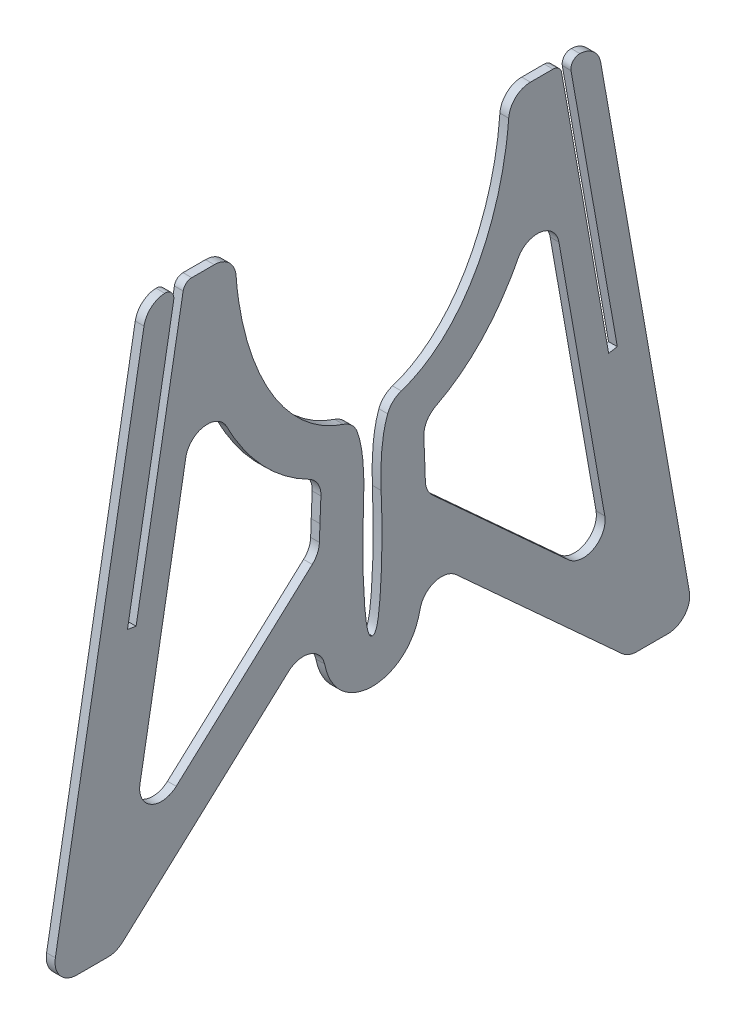
from build123d import *

# Parameters (mm, degrees)
BOSS_EXTRUDE1_START = -2
BOSS_EXTRUDE1_DEPTH = 2
CUT_EXTRUDE1_DEPTH  = 146.045019426
FILLET1_R           = 5
FILLET2_R           = 2


# Read off the part's stored shape, not the designer's step: Boss-Extrude1
with BuildPart() as part:
    # Boss-Extrude1 outline → Boss-Extrude1 (new body)
    with BuildSketch(Plane(origin=(0, 0, 0), x_dir=(0, 0, -1), z_dir=(1, 0, 0)).offset(BOSS_EXTRUDE1_START)):
        with BuildLine():
            Line((-31.104159696, 0), (-42.993921781, 0))
            Line((-42.993921781, 0), (-54.044792455, -62.672601944))
            Line((-54.044792455, -62.672601944), (-56.014407961, -62.325305589))
            Line((-56.014407961, -62.325305589), (-45.024775005, 0))
            Line((-45.024775005, 0), (-51.509348393, 0))
            Line((-51.509348393, 0), (-73.549852023, -124.997907533))
            Line((-73.549852023, -124.997907533), (-58.549852023, -124.997907533))
            Line((-58.549852023, -124.997907533), (-11.939671934, -82.474840347))
            add(Edge.make_bspline(
                [(-11.939671934, -82.474840347), (-11.935355711, -82.553696323), (-11.908963684, -83.029101377), (-11.861198564, -83.821519444), (-11.790671809, -84.858980093), (-11.717513927, -85.824379118), (-11.632640544, -86.818484558), (-11.531749306, -87.845762079), (-11.427577538, -88.745558158), (-11.327177243, -89.498001974), (-11.236962263, -90.105748379), (-11.128638978, -90.7493146), (-10.998597733, -91.430627515), (-10.825309589, -92.209112463), (-10.630662891, -92.95026858), (-10.40253371, -93.673319472), (-10.192750893, -94.265013644), (-9.871313525, -95.045802044), (-9.482878441, -95.827643678), (-9.049062095, -96.55568875), (-8.521948161, -97.338522417), (-7.641249277, -98.437270478), (-6.144891245, -99.687573695), (-4.900682791, -100.454782985), (-3.587929733, -101.012500135), (-2.185972262, -101.449627509), (-0.840761761, -101.628435243), (0, -101.628435628)],
                knots=[0.640422542, 0.640422542, 0.640422542, 0.640422542, 0.648235042, 0.6875, 0.71875, 0.75, 0.78125, 0.8125, 0.84375, 0.859375, 0.875, 0.890625, 0.90625, 0.921875, 0.9375, 0.9453125, 0.953125, 0.9609375, 0.96875, 0.97265625, 0.9765625, 0.984375, 0.98828125, 0.9921875, 0.994140625, 0.99609375, 0.999999943, 0.999999943, 0.999999943, 0.999999943], degree=3))
            Line((0, -101.628435628), (0, -91.628435628))
            add(Edge.make_bspline(
                [(-1.996093147, -63.790903591), (-2.016953814, -64.310897448), (-2.057843521, -65.377277496), (-2.114410047, -67.062494594), (-2.170282302, -69.132980676), (-2.206759496, -71.643380337), (-2.198909855, -74.557693398), (-2.141851983, -77.495638577), (-2.03862676, -80.417219816), (-1.906999833, -82.858340834), (-1.769185713, -84.802330189), (-1.64339081, -86.272582157), (-1.484029089, -87.725549834), (-1.300169984, -88.955939526), (-1.099675948, -89.895670749), (-0.926346322, -90.495626012), (-0.755888594, -90.925262358), (-0.604830393, -91.198944687), (-0.467331831, -91.382325985), (-0.355231075, -91.489370354), (-0.260483319, -91.554109132), (-0.177532424, -91.595338844), (-0.088022578, -91.622662129), (-0.02844763, -91.628435732), (0, -91.628435628)],
                knots=[0, 0, 0, 0, 0.056858997, 0.115117714, 0.174666559, 0.276173265, 0.380949766, 0.4832381, 0.587307052, 0.690484562, 0.742074386, 0.793661769, 0.84672234, 0.896832297, 0.925309889, 0.948412514, 0.962872069, 0.974162659, 0.981404301, 0.987060525, 0.990486198, 0.99351444, 0.996850743, 1, 1, 1, 1], degree=3))
            add(Edge.make_bspline(
                [(-5.40850068, -46.18111828), (-4.814029459, -46.989813108), (-4.62316879, -47.182494914), (-4.257171556, -47.761773753), (-4.121722002, -47.994840473), (-3.98973629, -48.240879613), (-3.861133263, -48.499522538), (-3.736118687, -48.770590656), (-3.523770844, -49.266466174), (-3.244338368, -50.030912003), (-2.862257922, -51.340609788), (-2.489243026, -53.097960835), (-2.206044449, -55.153686036), (-2.023322233, -57.336349251), (-1.952481579, -59.090269685), (-1.933290651, -60.570243141), (-1.937072034, -61.580206983), (-1.951509815, -62.443583814), (-1.974370908, -63.250331038), (-1.996093147, -63.790903591)],
                knots=[-0.064814313, -0.064814313, -0.064814313, -0.064814313, 0.01484251, 0.030242903, 0.046209104, 0.062746128, 0.07985625, 0.097539176, 0.115792209, 0.175719468, 0.242047121, 0.358129912, 0.494634184, 0.610597914, 0.747299436, 0.806507511, 0.873648736, 0.926792682, 1, 1, 1, 1], degree=3))
            add(Edge.make_bspline(
                [(-5.40850068, -46.18111828), (-5.413476324, -46.179800129), (-5.57383125, -46.137258314), (-5.890056914, -46.049510019), (-6.356204413, -45.909105044), (-6.82357897, -45.757113859), (-7.292033679, -45.593389256), (-7.76141714, -45.417787698), (-8.23157338, -45.230169437), (-8.702341769, -45.030398641), (-9.17355694, -44.818343516), (-9.645048704, -44.593876429), (-10.116641966, -44.356874038), (-10.58815664, -44.107217416), (-11.059407564, -43.844792178), (-11.530204404, -43.569488618), (-12.000351609, -43.281201809), (-12.469648161, -42.979831842), (-12.937888088, -42.665283567), (-13.404858092, -42.337468193), (-13.870346124, -41.996297869), (-14.798358851, -41.286742653), (-16.383411638, -39.943588682), (-18.72011642, -37.569230206), (-21.435787251, -34.128843123), (-23.915079965, -30.06399718), (-25.928877743, -25.851670318), (-27.395093005, -22.057925706), (-28.498079147, -18.555527337), (-29.214675372, -15.776562462), (-29.684930257, -13.636993912), (-30.000388954, -12.016466767), (-30.272967337, -10.416112453), (-30.504165896, -8.839158517), (-30.695529069, -7.28853535), (-30.84853957, -5.766871341), (-30.964992734, -4.276511615), (-31.045632618, -2.819530051), (-31.095922119, -1.245371081), (-31.104159696, -0.407987884), (-31.104159696, 0)],
                knots=[0.088444645, 0.088444645, 0.088444645, 0.088444645, 0.08869431, 0.09649159, 0.104361522, 0.112306369, 0.120328401, 0.128429883, 0.136613075, 0.144880222, 0.153233552, 0.161675267, 0.170207542, 0.178832517, 0.187552293, 0.196368925, 0.205284422, 0.214300742, 0.223419784, 0.232643387, 0.241973329, 0.251411318, 0.289304414, 0.342636817, 0.412725209, 0.501431509, 0.572967151, 0.638945746, 0.698546398, 0.750979916, 0.778092075, 0.804794861, 0.831051376, 0.856828362, 0.88209616, 0.906828635, 0.931003078, 0.954600091, 0.977603458, 1, 1, 1, 1], degree=3))
        make_face()
        with BuildLine():
            Line((-11.636928383, -54.637498368), (-11.988055922, -63.390054605))
            add(Edge.make_bspline(
                [(-11.988055922, -63.390054605), (-12.012003157, -63.98698734), (-12.056789243, -65.162707781), (-12.116273107, -66.963488426), (-12.150342529, -68.284951015), (-12.164660939, -68.990784983), (-12.167631246, -69.146508358)],
                knots=[0, 0, 0, 0, 0.0625, 0.125, 0.180233325, 0.195858325, 0.195858325, 0.195858325, 0.195858325], degree=3))
            Line((-12.167631246, -69.146508358), (-55.705474943, -108.866643511))
            Line((-55.705474943, -108.866643511), (-39.362027951, -16.178349715))
            add(Edge.make_bspline(
                [(-11.636928383, -54.637498368), (-12.064703437, -54.467830953), (-15.263185376, -53.121753167), (-21.191171859, -49.456661602), (-27.862750854, -42.631884323), (-33.021419872, -34.584564375), (-36.699642899, -26.185871472), (-38.509567935, -20.008289122), (-39.260459775, -16.652622382), (-39.362027951, -16.178349715)],
                knots=[0.131744052, 0.131744052, 0.131744052, 0.131744052, 0.147369052, 0.25, 0.375, 0.5, 0.625, 0.75, 0.770541565, 0.770541565, 0.770541565, 0.770541565], degree=3))
        make_face(mode=Mode.SUBTRACT)
    extrude(amount=BOSS_EXTRUDE1_DEPTH)

    # Sketch2 → Cut-Extrude1 (cut, through all)
    with BuildSketch(Plane.ZY.offset(2)):
        with BuildLine():
            add(Edge.make_bspline(
                [(0, -47.459928831), (-0.12969123, -47.459928831), (-0.390671867, -47.457507276), (-0.890916883, -47.442417671), (-1.339929131, -47.41858498), (-1.791493527, -47.38465259), (-2.245506059, -47.340672922), (-2.701859071, -47.286402006), (-3.160441185, -47.221679384), (-3.621137228, -47.146325358), (-4.08382816, -47.06016898), (-4.548390999, -46.963040617), (-5.014698746, -46.854774119), (-5.482620311, -46.73520638), (-5.952020435, -46.604177617), (-6.422759615, -46.461531444), (-6.894694026, -46.307115008), (-7.36767544, -46.140779113), (-7.841551149, -45.962378342), (-8.316163887, -45.771771181), (-8.791351744, -45.56882015), (-9.266948087, -45.353391928), (-9.742781477, -45.12535748), (-10.218675583, -44.88459219), (-10.694449103, -44.630975989), (-11.169915672, -44.364393488), (-11.644883773, -44.084734113), (-12.119156688, -43.79189222), (-12.59253225, -43.485767323), (-13.064803365, -43.166263853), (-13.535755598, -42.833292753), (-14.00517592, -42.486766066), (-14.941031953, -41.766031449), (-16.538425147, -40.402430413), (-18.891172853, -37.99393166), (-21.622751957, -34.508006637), (-24.115712132, -30.392337659), (-26.140403519, -26.129588937), (-27.614562986, -22.291679686), (-28.723096736, -18.75132514), (-29.443503495, -15.942745784), (-29.916494598, -13.779937777), (-30.234053361, -12.140558348), (-30.508392335, -10.522035968), (-30.741039248, -8.927635), (-30.933564783, -7.360316576), (-31.087476131, -5.822734158), (-31.204594073, -4.317252537), (-31.285679939, -2.845960152), (-31.336267327, -1.25501294), (-31.344524286, -0.411061022), (-31.344524286, 0)],
                knots=[0, 0, 0, 0, 0.007096671, 0.014240534, 0.0214334, 0.028677151, 0.035973737, 0.043325165, 0.050733505, 0.058200872, 0.065729433, 0.073321391, 0.080978987, 0.088704489, 0.096500189, 0.104368397, 0.112311433, 0.120331621, 0.128431286, 0.136612746, 0.144878305, 0.153230249, 0.16167084, 0.170202312, 0.178826862, 0.187546648, 0.196363783, 0.205280332, 0.214298305, 0.223419653, 0.232646268, 0.241979975, 0.25142253, 0.289339482, 0.342675062, 0.41275432, 0.501433824, 0.57301956, 0.639016666, 0.69860091, 0.750987238, 0.778128932, 0.804854906, 0.831128043, 0.856914911, 0.882185724, 0.906914257, 0.931077759, 0.954656826, 0.977635276, 1, 1, 1, 1], degree=3))
            add(Edge.make_bspline(
                [(-31.344524286, 0), (-31.344524286, 0.240171041), (-31.341721013, 0.728019575), (-31.324538017, 1.651954208), (-31.297247841, 2.495208136), (-31.258197231, 3.351062315), (-31.207334146, 4.219168745), (-31.144254911, 5.099149073), (-31.068653713, 5.990593669), (-30.980199661, 6.89306067), (-30.878570686, 7.806075014), (-30.763444511, 8.729127466), (-30.634501361, 9.661673622), (-30.49142347, 10.603132957), (-30.333895475, 11.552887636), (-30.161604517, 12.510282186), (-29.974240642, 13.474619868), (-29.771496283, 14.445171464), (-29.387963501, 16.158854462), (-28.725210821, 18.744033454), (-27.616368189, 22.286641788), (-26.141566091, 26.127045315), (-24.115727331, 30.392534337), (-21.621022907, 34.51076657), (-18.887196287, 37.998671665), (-16.532159837, 40.408419392), (-14.794630322, 41.890697573), (-13.56535723, 42.818605046), (-12.652127295, 43.452713604), (-11.734639966, 44.036619215), (-10.814374326, 44.571030109), (-9.892752491, 45.056716383), (-8.971120206, 45.494518874), (-8.050754828, 45.885342632), (-7.132866119, 46.230153707), (-6.218598808, 46.5299779), (-5.309034595, 46.785889077), (-4.405194201, 46.999036453), (-3.508039333, 47.170530077), (-2.618474567, 47.301842727), (-1.737349311, 47.393329265), (-0.761473426, 47.450771721), (-0.251782248, 47.459928831), (0, 47.459928831)],
                knots=[0, 0, 0, 0, 0.013074012, 0.02636173, 0.03986086, 0.053568762, 0.067482428, 0.081598479, 0.095913152, 0.110422289, 0.125121333, 0.140005314, 0.155068844, 0.170306113, 0.185710876, 0.201276455, 0.216995733, 0.232861151, 0.248864706, 0.3012821, 0.360903397, 0.426942415, 0.498573493, 0.587310162, 0.657436352, 0.710810988, 0.748760547, 0.76694077, 0.784719317, 0.802109631, 0.819126028, 0.835783591, 0.852098044, 0.868085623, 0.883762929, 0.899146777, 0.914254037, 0.929101471, 0.943705567, 0.958082382, 0.972247385, 0.986215305, 1, 1, 1, 1], degree=3))
            add(Edge.make_bspline(
                [(0, 47.459928831), (0.12969123, 47.459928831), (0.390671867, 47.457507276), (0.890916883, 47.442417671), (1.339929131, 47.41858498), (1.791493527, 47.38465259), (2.245506059, 47.340672922), (2.701859071, 47.286402006), (3.160441185, 47.221679384), (3.621137228, 47.146325358), (4.08382816, 47.06016898), (4.548390999, 46.963040617), (5.014698746, 46.854774119), (5.482620311, 46.73520638), (5.952020435, 46.604177617), (6.422759615, 46.461531444), (6.894694026, 46.307115008), (7.36767544, 46.140779113), (7.841551149, 45.962378342), (8.316163887, 45.771771181), (8.791351744, 45.56882015), (9.266948087, 45.353391928), (9.742781477, 45.12535748), (10.218675583, 44.88459219), (10.694449103, 44.630975989), (11.169915672, 44.364393488), (11.644883773, 44.084734113), (12.119156688, 43.79189222), (12.59253225, 43.485767323), (13.064803365, 43.166263853), (13.535755598, 42.833292753), (14.00517592, 42.486766066), (14.941031953, 41.766031449), (16.538425147, 40.402430413), (18.891172853, 37.99393166), (21.622751957, 34.508006637), (24.115712132, 30.392337659), (26.140403519, 26.129588937), (27.614562986, 22.291679686), (28.723096736, 18.75132514), (29.443503495, 15.942745784), (29.916494598, 13.779937777), (30.234053361, 12.140558348), (30.508392335, 10.522035968), (30.741039248, 8.927635), (30.933564783, 7.360316576), (31.087476131, 5.822734158), (31.204594073, 4.317252537), (31.285679939, 2.845960152), (31.336267327, 1.25501294), (31.344524286, 0.411061022), (31.344524286, 0)],
                knots=[0, 0, 0, 0, 0.007096671, 0.014240534, 0.0214334, 0.028677151, 0.035973737, 0.043325165, 0.050733505, 0.058200872, 0.065729433, 0.073321391, 0.080978987, 0.088704489, 0.096500189, 0.104368397, 0.112311433, 0.120331621, 0.128431286, 0.136612746, 0.144878305, 0.153230249, 0.16167084, 0.170202312, 0.178826862, 0.187546648, 0.196363783, 0.205280332, 0.214298305, 0.223419653, 0.232646268, 0.241979975, 0.25142253, 0.289339482, 0.342675062, 0.41275432, 0.501433824, 0.57301956, 0.639016666, 0.69860091, 0.750987238, 0.778128932, 0.804854906, 0.831128043, 0.856914911, 0.882185724, 0.906914257, 0.931077759, 0.954656826, 0.977635276, 1, 1, 1, 1], degree=3))
            add(Edge.make_bspline(
                [(31.344524286, 0), (31.344524286, -0.240171041), (31.341721013, -0.728019575), (31.324538017, -1.651954208), (31.297247841, -2.495208136), (31.258197231, -3.351062315), (31.207334146, -4.219168745), (31.144254911, -5.099149073), (31.068653713, -5.990593669), (30.980199661, -6.89306067), (30.878570686, -7.806075014), (30.763444511, -8.729127466), (30.634501361, -9.661673622), (30.49142347, -10.603132957), (30.333895475, -11.552887636), (30.161604517, -12.510282186), (29.974240642, -13.474619868), (29.771496283, -14.445171464), (29.387963501, -16.158854462), (28.725210821, -18.744033454), (27.616368189, -22.286641788), (26.141566091, -26.127045315), (24.115727331, -30.392534337), (21.621022907, -34.51076657), (18.887196287, -37.998671665), (16.532159837, -40.408419392), (14.794630322, -41.890697573), (13.56535723, -42.818605046), (12.652127295, -43.452713604), (11.734639966, -44.036619215), (10.814374326, -44.571030109), (9.892752491, -45.056716383), (8.971120206, -45.494518874), (8.050754828, -45.885342632), (7.132866119, -46.230153707), (6.218598808, -46.5299779), (5.309034595, -46.785889077), (4.405194201, -46.999036453), (3.508039333, -47.170530077), (2.618474567, -47.301842727), (1.737349311, -47.393329265), (0.761473426, -47.450771721), (0.251782248, -47.459928831), (0, -47.459928831)],
                knots=[0, 0, 0, 0, 0.013074012, 0.02636173, 0.03986086, 0.053568762, 0.067482428, 0.081598479, 0.095913152, 0.110422289, 0.125121333, 0.140005314, 0.155068844, 0.170306113, 0.185710876, 0.201276455, 0.216995733, 0.232861151, 0.248864706, 0.3012821, 0.360903397, 0.426942415, 0.498573493, 0.587310162, 0.657436352, 0.710810988, 0.748760547, 0.76694077, 0.784719317, 0.802109631, 0.819126028, 0.835783591, 0.852098044, 0.868085623, 0.883762929, 0.899146777, 0.914254037, 0.929101471, 0.943705567, 0.958082382, 0.972247385, 0.986215305, 1, 1, 1, 1], degree=3))
        make_face()
    extrude(amount=-CUT_EXTRUDE1_DEPTH, mode=Mode.SUBTRACT)

    # Fillet1
    fillet1_edges = [part.edges().sort_by_distance(p)[0] for p in [
        (-1, -54.637498368, 11.636928383),
        (-1, -16.178349715, 39.362027951),
        (-1, -108.866643511, 55.705474943),
        (-1, -69.146508358, 12.167631246),
        (-1, -82.474840347, 11.939671934),
        (-1, -124.997907533, 58.549852023),
        (-1, -124.997907533, 73.549852023),
        (-1, 0, 51.509348393),
        (-1, -46.885774548, 4.878220981),
        (-1, 0, 31.344524286),
    ]]
    fillet(fillet1_edges, radius=FILLET1_R)

    # Mirror2: part across plane


with BuildPart() as part_1:
    add(part.part)
    add(part.part.mirror(Plane(origin=(-2, 0, 0), x_dir=(1, 0, 0), z_dir=(0, 0, 1))))

    # Fillet2
    fillet2_edges = [part_1.edges().sort_by_distance(p)[0] for p in [
        (-1, 0, 42.993921781),
        (-1, 0, 45.024775005),
        (-1, 0, -42.993921781),
        (-1, 0, -45.024775005),
    ]]
    fillet(fillet2_edges, radius=FILLET2_R)


solid = part_1.part
